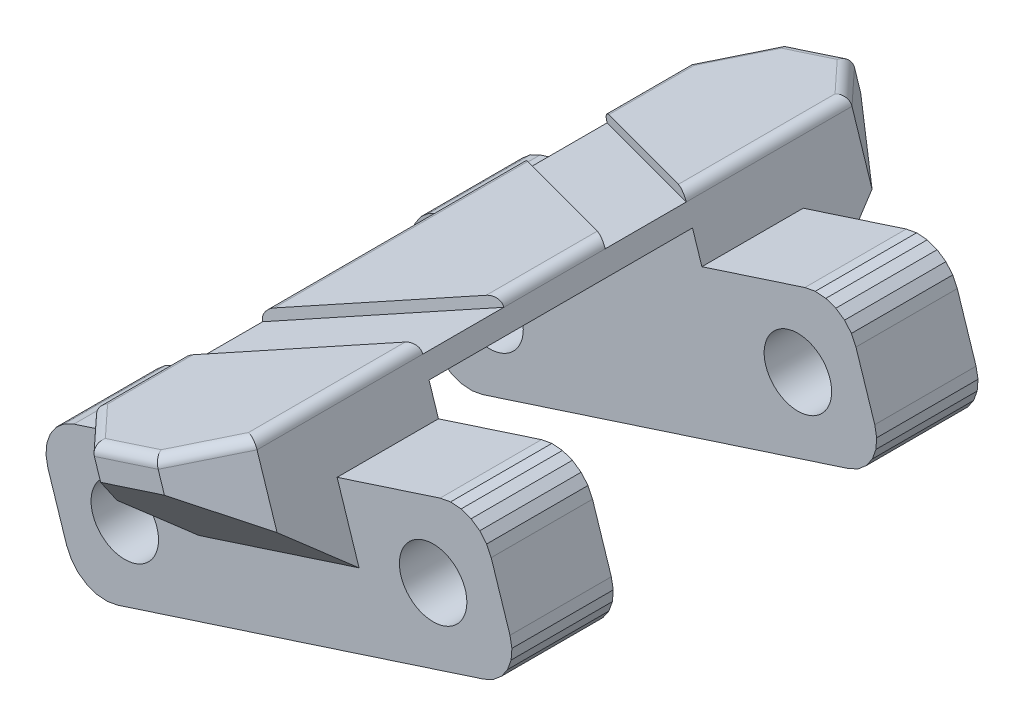
from build123d import *

# Parameters (mm, degrees)
MODEL_R             = 1.665
BOSS_EXTRUDE1_DEPTH = 5
SKETCH2_W           = 8.310460331
SKETCH2_H           = 5
BOSS_EXTRUDE2_DEPTH = 1.5
BOSS_EXTRUDE3_DEPTH = 1.5
BOSS_EXTRUDE4_DEPTH = 5.68
BOSS_EXTRUDE5_DEPTH = 8.31
CUT_EXTRUDE1_DEPTH  = 0.5
CHAMFER1_SIZE       = 2.5
FILLET1_R           = 0.5


with BuildPart() as part:
    # Model → Boss-Extrude1 (new body)
    with BuildSketch(Plane.XY):
        Polygon((17.1125, 65.2434), (16.6413, 65.0186), (16.2442, 64.6796), (15.9485, 64.2493), (15.7742, 63.7571), (15.7333, 63.2366), (15.8284, 62.7233), (16.7555, 59.8701), (16.9802, 59.3988), (17.3193, 59.0018), (17.7496, 58.7061), (18.2418, 58.5318), (18.7623, 58.4909), (19.2756, 58.586), (37.3457, 64.4573), (37.8169, 64.6821), (38.214, 65.0212), (38.5097, 65.4515), (38.684, 65.9436), (38.7249, 66.4641), (38.6298, 66.9775), (37.7027, 69.8306), (37.478, 70.3019), (37.1389, 70.6989), (36.7086, 70.9946), (36.2164, 71.1689), (35.6959, 71.2099), (35.1826, 71.1147), align=None)
        with Locations((34.8376, 67.3225)):
            Circle(MODEL_R, mode=Mode.SUBTRACT)
        with Locations((19.6206, 62.3782)):
            Circle(MODEL_R, mode=Mode.SUBTRACT)
    boss_extrude1 = extrude(amount=BOSS_EXTRUDE1_DEPTH)

    # Sketch2 → Boss-Extrude2 (add)
    with BuildSketch(Plane(origin=(-17.540388664, 53.984054163, 0), x_dir=(0.9510570020345874, 0.3090154994186907, 0), z_dir=(-0.3090154994186907, 0.9510570020345874, 0))):
        with Locations((45.9361937, -2.5)):
            Rectangle(SKETCH2_W, SKETCH2_H)
    boss_extrude2 = extrude(amount=BOSS_EXTRUDE2_DEPTH)

    # Sketch3 → Boss-Extrude3 (add)
    with BuildSketch(Plane(origin=(-18.003911914, 55.410639666, 0), x_dir=(0.9510570020345874, 0.30901549941869066, 0), z_dir=(-0.30901549941869066, 0.9510570020345874, 0))):
        Polygon((41.780963534, 0), (41.780963534, -5), (41.780963534, -11.5), (50.091423865, -11.5), (50.091423865, -5), (50.091423865, 0), align=None)
    boss_extrude3 = extrude(amount=BOSS_EXTRUDE3_DEPTH)

    # Mirror4: Boss-Extrude3 across plane
    add(boss_extrude3.mirror(Plane.XY.offset(11.5)))

    # Mirror5: Boss-Extrude2 across plane
    add(boss_extrude2.mirror(Plane.XY.offset(11.5)))

    # Mirror8: Boss-Extrude1 across plane
    add(boss_extrude1.mirror(Plane.XY.offset(11.5)))

    # Sketch5 → Boss-Extrude4 (add)
    with BuildSketch(Plane(origin=(0, 0, 0), x_dir=(-1, 0, 0), z_dir=(0, 0, -1))):
        Polygon((-29.172364246, 72.316251531), (-29.635887495, 70.889666028), (-21.732166007, 68.321604978), (-21.268642758, 69.748190481), align=None)
    boss_extrude4 = extrude(amount=BOSS_EXTRUDE4_DEPTH)

    # Mirror9: Boss-Extrude4 across plane
    add(boss_extrude4.mirror(Plane.XY.offset(11.5)))

    # Sketch7 → Boss-Extrude5 (add)
    with BuildSketch(Plane(origin=(47.639799409, 15.479026362, 0), x_dir=(0, 0, -1), z_dir=(0.9510570020345875, 0.3090154994186908, 0))):
        Polygon((5.68, 58.262164673), (0, 58.262164673), (0, 53.262164673), align=None)
    boss_extrude5 = extrude(amount=-BOSS_EXTRUDE5_DEPTH)

    # Mirror10: Boss-Extrude5 across plane
    add(boss_extrude5.mirror(Plane.XY.offset(11.5)))

    # Sketch8 → Cut-Extrude1 (cut)
    with BuildSketch(Plane(origin=(-18.467435163, 56.837225169, 0), x_dir=(0.9510570020345874, 0.30901549941869066, 0), z_dir=(-0.30901549941869066, 0.9510570020345874, 0))):
        Polygon((45.936193699, -7), (50.091423865, -9), (50.091423865, -5), (41.780963534, -1), (41.780963534, -5), align=None)
    cut_extrude1 = extrude(amount=-CUT_EXTRUDE1_DEPTH, mode=Mode.SUBTRACT)

    # Mirror11: Cut-Extrude1 across plane
    add(cut_extrude1.mirror(Plane.XY.offset(11.5)), mode=Mode.SUBTRACT)

    # Chamfer1
    # the kernel refuses this chamfer: 2.5 mm, written as the material it takes off along each edge
    with BuildSketch(Plane(origin=(27.185639489, 78.430794313, -5.68), x_dir=(0.02615014597757756, 0.008496652042775076, 0.9996219169112968), z_dir=(0.30901549941868806, -0.9510570020345883, 0)), Plane(origin=(23.718890764, 62.207062196, -5.68), x_dir=(-0.026150145977578018, -0.008496652042775138, 0.9996219169112968), z_dir=(-0.30901549941868506, 0.9510570020345892, 0))) as chamfer1_piece_1:
        Polygon((CHAMFER1_SIZE * 0.999621916911, CHAMFER1_SIZE * 0.0274958766106), (-CHAMFER1_SIZE * 0.0274958766106, CHAMFER1_SIZE * 0.999621916911), (0, 0), align=None)
    extrude(amount=14.35841494, mode=Mode.SUBTRACT)
    with BuildSketch(Plane(origin=(23.718890764, 62.207062196, 28.68), x_dir=(-0.026150145977578018, -0.008496652042775138, -0.9996219169112968), z_dir=(-0.30901549941868506, 0.9510570020345892, 0)), Plane(origin=(27.185639489, 78.430794313, 28.68), x_dir=(0.02615014597757756, 0.008496652042775076, -0.9996219169112968), z_dir=(0.30901549941868806, -0.9510570020345883, 0))) as chamfer1_piece_2:
        Polygon((CHAMFER1_SIZE * 0.999621916911, -CHAMFER1_SIZE * 0.0274958766106), (-CHAMFER1_SIZE * 0.0274958766106, -CHAMFER1_SIZE * 0.999621916911), (0, 0), align=None)
    extrude(amount=14.35841494, mode=Mode.SUBTRACT)

    # Fillet1
    fillet1_edges = [part.edges().sort_by_distance(p)[0] for p in [
        (29.172364246, 72.316251531, 0.91),
        (21.268642758, 69.748190481, 11.5),
        (29.172364246, 72.316251531, 11.5),
        (21.268642758, 69.748190481, 24.09),
        (21.268642758, 69.748190481, -1.09),
        (25.220503502, 71.032221006, 28.68),
        (29.172364246, 72.316251531, 22.09),
        (27.983542993, 71.929982157, 27.43),
        (22.45746401, 70.134459856, 27.43),
        (25.220503502, 71.032221006, -5.68),
        (22.45746401, 70.134459856, -4.43),
        (27.983542993, 71.929982157, -4.43),
    ]]
    fillet(fillet1_edges, radius=FILLET1_R)


solid = part.part
